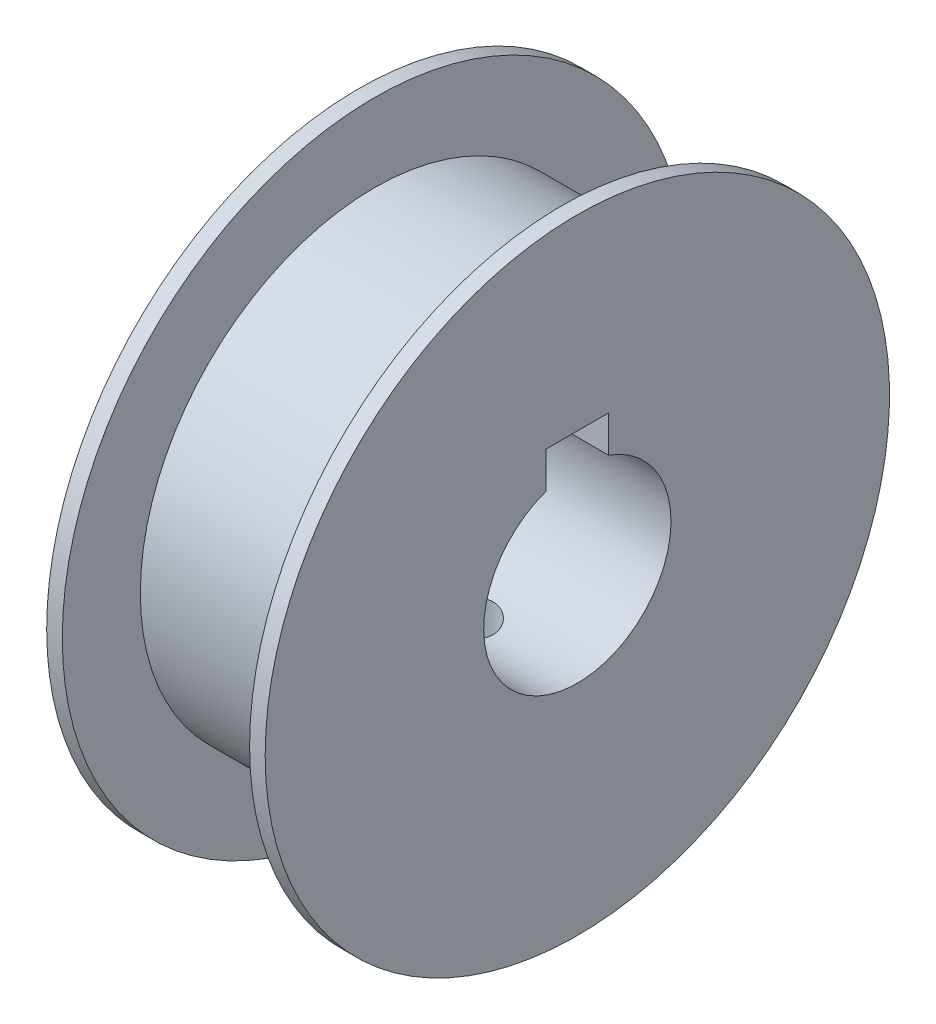
from build123d import *

# Parameters (mm, degrees)
SKETCH_3_R          = 1.6
CUT_EXTRUDE_1_DEPTH = 64.287719075
SKETCH_4_W          = 4
SKETCH_4_H          = 4
CUT_EXTRUDE_2_DEPTH = 47.909338485


with BuildPart() as part:
    # ｽｹｯﾁ2 → 回転1 (revolve)
    with BuildSketch(Plane(origin=(0, 0, 0), x_dir=(1, 0, 0), z_dir=(0, 1, 0))):
        Polygon((-44.73085458, -0.056036178), (-44.73085458, -14.056036178), (-30.73085458, -14.056036178), (-30.73085458, -0.056036178), (-31.73085458, -0.056036178), (-31.73085458, -5.056036178), (-43.73085458, -5.056036178), (-43.73085458, -0.056036178), align=None)
    revolve(axis=Axis((-49.849406884, 0, 20.056036178), (1, 0, 0)))

    # ｽｹｯﾁ3 → ｶｯﾄ - 押し出し1 (cut, through all)
    with BuildSketch(Plane(origin=(0, 0, 0), x_dir=(1, 0, 0), z_dir=(0, 1, 0))):
        with Locations((-37.73085458, -20.056036178)):
            Circle(SKETCH_3_R)
    extrude(amount=-CUT_EXTRUDE_1_DEPTH, mode=Mode.SUBTRACT)

    # ｽｹｯﾁ4 → ｶｯﾄ - 押し出し2 (cut, through all)
    with BuildSketch(Plane(origin=(-30.73085458, 0, 0), x_dir=(0, 0, -1), z_dir=(1, 0, 0))):
        with Locations((-20.056036178, 6)):
            Rectangle(SKETCH_4_W, SKETCH_4_H)
    extrude(amount=-CUT_EXTRUDE_2_DEPTH, mode=Mode.SUBTRACT)


solid = part.part
